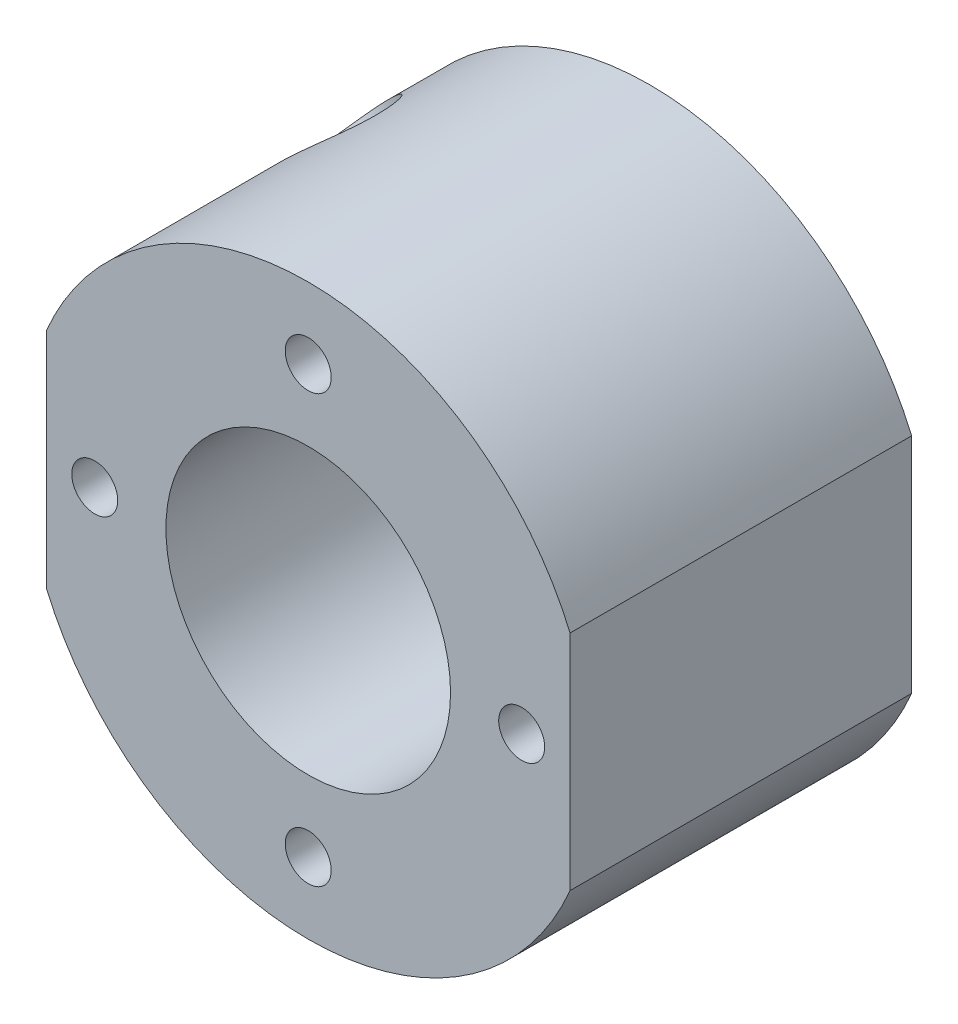
from build123d import *

# Parameters (mm, degrees)
BOSS_EXTRUDE1_DEPTH    = 30
SKETCH6_R              = 12.5
CUT_EXTRUDE1_DEPTH     = 25
F_10_32_TAPPED_HOLE1_D = 4.0386


# Read off the part's stored shape, not the designer's step: 1/8 NPT Tapped Hole1
with BuildPart() as part:
    # Sketch2 → Boss-Extrude1 (new body)
    with BuildSketch(Plane.XY):
        with BuildLine():
            Line((-23, 9.797958971), (-23, -9.797958971))
            ThreePointArc((-23, -9.797958971), (0, -25), (23, -9.797958971))
            Line((23, -9.797958971), (23, 9.797958971))
            ThreePointArc((23, 9.797958971), (0, 25), (-23, 9.797958971))
        make_face()
    extrude(amount=BOSS_EXTRUDE1_DEPTH)

    # Sketch6 → Cut-Extrude1 (cut)
    with BuildSketch(Plane(origin=(0, 0, 30), x_dir=(-1, 0, 0), z_dir=(0, 0, 1))):
        with Locations(Location((0, 0, 0), (0, 0, 180))):
            Circle(SKETCH6_R)
    extrude(amount=-CUT_EXTRUDE1_DEPTH, mode=Mode.SUBTRACT)

    # #10-32 Tapped Hole1 (through all)
    with Locations(Plane.XY.offset(30)):
        with Locations((-18.75, 0), (0, 18.75), (18.75, 0), (0, -18.75)):
            Hole(F_10_32_TAPPED_HOLE1_D / 2)

    # 1/8 NPT Tapped Hole1 outline → 1/8 NPT Tapped Hole1 (revolve, cut)
    with BuildSketch(Plane(origin=(0, 0, 10), x_dir=(0.707106781186546, 0.707106781186549, 0), z_dir=(0, 0, -1))):
        Polygon((4.744600282, -25.000243213), (4.537398933, -18.08), (4.2164, -18.08), (4.2164, -11.766981388), (0, -11.766981388), (0, -25.000243213), align=None)
    revolve(axis=Axis((0, 0, 10), (0.707106781186549, -0.707106781186546, 0)), mode=Mode.SUBTRACT)


solid = part.part
